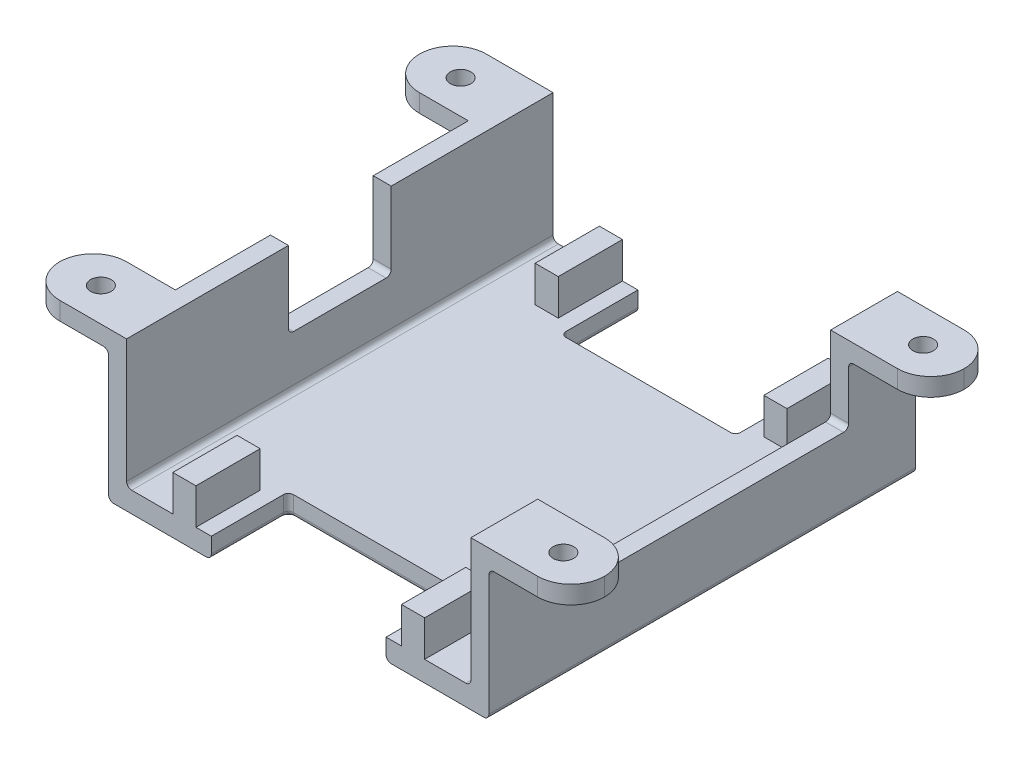
from build123d import *

# Parameters (mm, degrees)
SKETCH1_W                       = 74
SKETCH1_H                       = 53
BOSS_EXTRUDE1_DEPTH             = 4
SKETCH2_W                       = 3.5
SKETCH2_H                       = 53
BOSS_EXTRUDE2_DEPTH             = 25
CUT_EXTRUDE1_REACH              = 85.781
SKETCH3_W                       = 20
SKETCH3_H                       = 15
SKETCH5_W                       = 20
SKETCH5_H                       = 4
BOSS_EXTRUDE4_DEPTH             = 15
MIRROR4_COPY_1_SKETCH_W         = 20
MIRROR4_COPY_1_SKETCH_H         = 4
MIRROR4_COPY_1_DEPTH            = 15
SKETCH6_W                       = 3.5
SKETCH6_H                       = 15
BOSS_EXTRUDE5_DEPTH             = 25
MIRROR6_COPY_1_SKETCH_W         = 3.5
MIRROR6_COPY_1_SKETCH_H         = 15
MIRROR6_COPY_1_DEPTH            = 25
MIRROR6_COPY_2_SKETCH_W         = 3.5
MIRROR6_COPY_2_SKETCH_H         = 15
MIRROR6_COPY_2_DEPTH            = 25
SKETCH7_W                       = 4.5
SKETCH7_H                       = 12.5
BOSS_EXTRUDE6_DEPTH             = 7
MIRROR8_COPY_1_SKETCH_W         = 4.5
MIRROR8_COPY_1_SKETCH_H         = 12.5
MIRROR8_COPY_1_DEPTH            = 7
SKETCH8_W                       = 13
SKETCH8_H                       = 3.5
BOSS_EXTRUDE7_DEPTH             = 16
MIRROR10_COPY_1_SKETCH_W        = 13
MIRROR10_COPY_1_SKETCH_H        = 3.5
MIRROR10_COPY_1_DEPTH           = 16
CUT_EXTRUDE2_REACH              = 105.263
SKETCH9_W                       = 57
SKETCH9_H                       = 15
F_4_0MM_CLEARANCE_DOWEL_HOLE1_D = 4
FILLET1_R                       = 6.5
FILLET2_R                       = 1
FILLET3_R                       = 1


with BuildPart() as part:
    # Sketch1 → Boss-Extrude1 (new body)
    with BuildSketch(Plane(origin=(0, 0, 0), x_dir=(1, 0, 0), z_dir=(0, 1, 0))):
        Rectangle(SKETCH1_W, SKETCH1_H)
    extrude(amount=BOSS_EXTRUDE1_DEPTH)

    # Sketch2 → Boss-Extrude2 (add)
    with BuildSketch(Plane(origin=(0, 4, 0), x_dir=(1, 0, 0), z_dir=(0, 1, 0))):
        with Locations((-35.25, 0)):
            Rectangle(SKETCH2_W, SKETCH2_H)
    boss_extrude2 = extrude(amount=BOSS_EXTRUDE2_DEPTH)

    # Mirror1: Boss-Extrude2 across plane
    add(boss_extrude2.mirror(Plane(origin=(0, 0, 0), x_dir=(0, 0, 1), z_dir=(1, 0, 0))))

    # Sketch3 → Cut-Extrude1 (cut, up to next)
    with BuildSketch(Plane.ZY.offset(37), mode=Mode.PRIVATE) as cut_extrude1_sk1:
        with Locations((0, 21.5)):
            Rectangle(SKETCH3_W, SKETCH3_H)
    cut_extrude1_tool1 = extrude(cut_extrude1_sk1.sketch, amount=-CUT_EXTRUDE1_REACH, mode=Mode.PRIVATE) & part.part
    add(cut_extrude1_tool1.solids().sort_by_distance((-37, 21.5, 0))[0], mode=Mode.SUBTRACT)

    # Sketch5 → Boss-Extrude4 (add)
    with BuildSketch(Plane(origin=(0, 0, -26.5), x_dir=(-1, 0, 0), z_dir=(0, 0, -1))):
        with Locations((27, 2)):
            Rectangle(SKETCH5_W, SKETCH5_H)
    boss_extrude4 = extrude(amount=BOSS_EXTRUDE4_DEPTH)

    # Mirror3: Boss-Extrude4 across plane
    add(boss_extrude4.mirror(Plane.XY))

    # Mirror4: Boss-Extrude4 across plane
    add(boss_extrude4.mirror(Plane(origin=(0, 0, 0), x_dir=(0, 0, 1), z_dir=(1, 0, 0))))

    # Mirror4 copy 1 sketch → Mirror4 copy 1 (add)
    with BuildSketch(Plane.XY.offset(26.5)):
        with Locations((27, 2)):
            Rectangle(MIRROR4_COPY_1_SKETCH_W, MIRROR4_COPY_1_SKETCH_H)
    extrude(amount=MIRROR4_COPY_1_DEPTH)

    # Sketch6 → Boss-Extrude5 (add)
    with BuildSketch(Plane(origin=(0, 4, 0), x_dir=(1, 0, 0), z_dir=(0, 1, 0))):
        with Locations((-35.25, 34)):
            Rectangle(SKETCH6_W, SKETCH6_H)
    boss_extrude5 = extrude(amount=BOSS_EXTRUDE5_DEPTH)

    # Mirror5: Boss-Extrude5 across plane
    add(boss_extrude5.mirror(Plane.XY))

    # Mirror6 copy 1 sketch → Mirror6 copy 1 (add)
    with BuildSketch(Plane(origin=(0, 4, 0), x_dir=(-1, 0, 0), z_dir=(0, 1, 0))):
        with Locations((-35.25, 34)):
            Rectangle(MIRROR6_COPY_1_SKETCH_W, MIRROR6_COPY_1_SKETCH_H)
    extrude(amount=MIRROR6_COPY_1_DEPTH)

    # Mirror6 copy 2 sketch → Mirror6 copy 2 (add)
    with BuildSketch(Plane(origin=(0, 4, 0), x_dir=(-1, 0, 0), z_dir=(0, 1, 0))):
        with Locations((-35.25, -34)):
            Rectangle(MIRROR6_COPY_2_SKETCH_W, MIRROR6_COPY_2_SKETCH_H)
    extrude(amount=MIRROR6_COPY_2_DEPTH)

    # Sketch7 → Boss-Extrude6 (add)
    with BuildSketch(Plane(origin=(0, 4, 0), x_dir=(1, 0, 0), z_dir=(0, 1, 0))):
        with Locations((-22.25, 35.25)):
            Rectangle(SKETCH7_W, SKETCH7_H)
    boss_extrude6 = extrude(amount=BOSS_EXTRUDE6_DEPTH)

    # Mirror7: Boss-Extrude6 across plane
    add(boss_extrude6.mirror(Plane.XY))

    # Mirror8: Boss-Extrude6 across plane
    add(boss_extrude6.mirror(Plane(origin=(0, 0, 0), x_dir=(0, 0, 1), z_dir=(1, 0, 0))))

    # Mirror8 copy 1 sketch → Mirror8 copy 1 (add)
    with BuildSketch(Plane(origin=(0, 4, 0), x_dir=(-1, 0, 0), z_dir=(0, 1, 0))):
        with Locations((-22.25, 35.25)):
            Rectangle(MIRROR8_COPY_1_SKETCH_W, MIRROR8_COPY_1_SKETCH_H)
    extrude(amount=MIRROR8_COPY_1_DEPTH)

    # Sketch8 → Boss-Extrude7 (add)
    with BuildSketch(Plane.ZY.offset(37)):
        with Locations((-35, 27.25)):
            Rectangle(SKETCH8_W, SKETCH8_H)
    boss_extrude7 = extrude(amount=BOSS_EXTRUDE7_DEPTH)

    # Mirror9: Boss-Extrude7 across plane
    add(boss_extrude7.mirror(Plane.XY))

    # Mirror10: Boss-Extrude7 across plane
    add(boss_extrude7.mirror(Plane(origin=(0, 0, 0), x_dir=(0, 0, 1), z_dir=(1, 0, 0))))

    # Mirror10 copy 1 sketch → Mirror10 copy 1 (add)
    with BuildSketch(Plane(origin=(37, 0, 0), x_dir=(0, 0, -1), z_dir=(1, 0, 0))):
        with Locations((-35, 27.25)):
            Rectangle(MIRROR10_COPY_1_SKETCH_W, MIRROR10_COPY_1_SKETCH_H)
    extrude(amount=MIRROR10_COPY_1_DEPTH)

    # Sketch9 → Cut-Extrude2 (cut, up to next)
    with BuildSketch(Plane(origin=(37, 0, 0), x_dir=(0, 0, -1), z_dir=(1, 0, 0)), mode=Mode.PRIVATE) as cut_extrude2_sk1:
        with Locations((0, 21.5)):
            Rectangle(SKETCH9_W, SKETCH9_H)
    cut_extrude2_tool1 = extrude(cut_extrude2_sk1.sketch, amount=-CUT_EXTRUDE2_REACH, mode=Mode.PRIVATE) & part.part
    add(cut_extrude2_tool1.solids().sort_by_distance((37, 21.5, 0))[0], mode=Mode.SUBTRACT)

    # Ø4.0mm Clearance Dowel Hole1 (through all)
    with Locations(Plane(origin=(0, 25.5, 0), x_dir=(-1, 0, 0), z_dir=(0, -1, 0))):
        with Locations((-45, 35), (-45, -35), (45, 35), (45, -35)):
            Hole(F_4_0MM_CLEARANCE_DOWEL_HOLE1_D / 2)

    # Fillet1
    fillet1_edges = [part.edges().sort_by_distance(p)[0] for p in [
        (-53, 27.25, -41.5),
        (-53, 27.25, -28.5),
        (-53, 27.25, 41.5),
        (-53, 27.25, 28.5),
        (53, 27.25, 41.5),
        (53, 27.25, 28.5),
        (53, 27.25, -41.5),
        (53, 27.25, -28.5),
    ]]
    fillet(fillet1_edges, radius=FILLET1_R - 0.0001)  # a hair under: the kernel refuses the full size

    # Fillet2
    fillet2_edges = [part.edges().sort_by_distance(p)[0] for p in [
        (-33.5, 4, 0),
        (-37, 25.5, -35),
        (-37, 25.5, 35),
        (37, 25.5, 35),
        (37, 25.5, -35),
        (35.25, 14, 28.5),
        (35.25, 14, -28.5),
        (33.5, 4, 0),
        (-35.25, 14, -10),
        (-35.25, 14, 10),
        (-17, 2, -26.5),
        (-17, 2, 26.5),
        (17, 2, 26.5),
        (17, 2, -26.5),
    ]]
    fillet(fillet2_edges, radius=FILLET2_R)

    # Fillet3
    fillet3_edges = [part.edges().sort_by_distance(p)[0] for p in [
        (0, 0, -26.5),
        (0, 0, 26.5),
        (16.707106781, 0, -26.792893219),
        (-16.707106781, 0, -26.792893219),
        (-16.707106781, 0, 26.792893219),
        (16.707106781, 0, 26.792893219),
        (-37, 0, 0),
        (37, 0, 0),
        (-17, 0, -34.5),
        (-17, 0, 34.5),
        (17, 0, 34.5),
        (17, 0, -34.5),
    ]]
    fillet(fillet3_edges, radius=FILLET3_R)


solid = part.part
